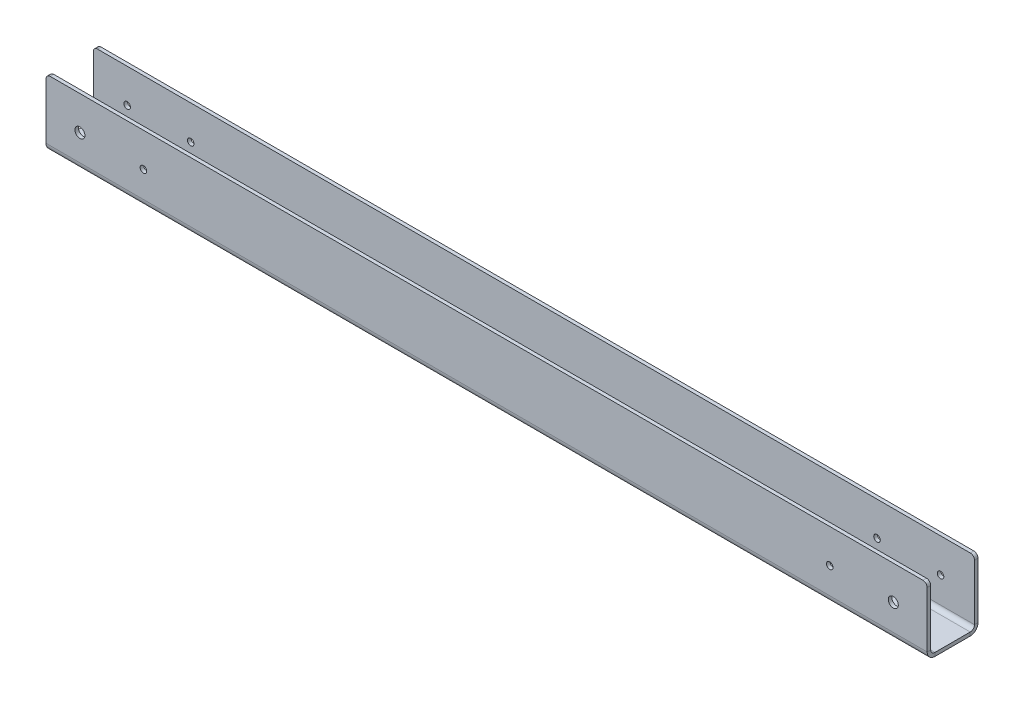
from build123d import *

# Parameters (mm, degrees)
SKETCH1_W                            = 660.4
SKETCH1_H                            = 38.1
BASE_FLANGE1_DEPTH                   = 2.65684
EDGE_FLANGE1_STRIP_W                 = 16.97736
EDGE_FLANGE1_STRIP_H                 = 2.65684
EDGE_FLANGE1_STRIP_CUT_DEPTH         = 660.4
EDGE_FLANGE1_STRIP_2_W               = 16.97736
EDGE_FLANGE1_STRIP_2_H               = 2.65684
EDGE_FLANGE1_STRIP_CUT_2_DEPTH       = 660.4
EDGE_FLANGE1_DEPTH                   = 660.4
EDGE_FLANGE1_BEND_DEPTH              = 660.4
F_10_0_1935_DIAMETER_HOLE2_D         = 4.9149
F_10_0_1935_DIAMETER_HOLE2_DEPTH     = 2.65684
FILLET1_R                            = 3.175
F_10_0_1935_DIAMETER_HOLE3_D         = 4.9149
F_19_64_0_29688_DIAMETER_HOLE1_D     = 7.540752
F_19_64_0_29688_DIAMETER_HOLE1_DEPTH = 2.65684


# Sheet-metal steps are written as plain solids
with BuildPart() as part:
    # Sketch1 → Base-Flange1 (new body)
    with BuildSketch(Plane(origin=(0, 0, 0), x_dir=(1, 0, 0), z_dir=(0, 1, 0))):
        with Locations((375.92, 15.875)):
            Rectangle(SKETCH1_W, SKETCH1_H)
    extrude(amount=-BASE_FLANGE1_DEPTH)

    # Edge-Flange1 strip (across the edge) → Edge-Flange1 strip cut (cut)
    with BuildSketch(Plane(origin=(45.72, 0, 3.175), x_dir=(0, 0, -1), z_dir=(1, 0, 0))):
        with Locations((-2.65684, -1.32842)):
            Rectangle(EDGE_FLANGE1_STRIP_W, EDGE_FLANGE1_STRIP_H)
    extrude(amount=EDGE_FLANGE1_STRIP_CUT_DEPTH, mode=Mode.SUBTRACT)

    # Edge-Flange1 strip 2 (across the edge) → Edge-Flange1 strip cut 2 (cut)
    with BuildSketch(Plane(origin=(706.12, 0, -34.925), x_dir=(0, 0, 1), z_dir=(-1, 0, 0))):
        with Locations((-2.65684, -1.32842)):
            Rectangle(EDGE_FLANGE1_STRIP_2_W, EDGE_FLANGE1_STRIP_2_H)
    extrude(amount=EDGE_FLANGE1_STRIP_CUT_2_DEPTH, mode=Mode.SUBTRACT)

    # Edge-Flange1 section (across the edge) → Edge-Flange1 (add)
    with BuildSketch(Plane(origin=(45.72, 0, 3.175), x_dir=(0, 0, -1), z_dir=(1, 0, 0))):
        with BuildLine():
            Line((0, 3.175), (0, 48.14316))
            Line((0, 48.14316), (2.65684, 48.14316))
            Line((2.65684, 48.14316), (2.65684, 3.175))
            ThreePointArc((2.65684, 3.175), (3.58677597, 0.92993597), (5.83184, 0))
            Line((5.83184, 0), (5.83184, -2.65684))
            ThreePointArc((5.83184, -2.65684), (1.708106389, -0.948733611), (0, 3.175))
        make_face()
    extrude(amount=EDGE_FLANGE1_DEPTH)

    # Edge-Flange1 section 2 (across the edge) → Edge-Flange1 bend (add)
    with BuildSketch(Plane(origin=(706.12, 0, -34.925), x_dir=(0, 0, 1), z_dir=(-1, 0, 0))):
        with BuildLine():
            Line((0, 3.175), (0, 48.14316))
            Line((0, 48.14316), (2.65684, 48.14316))
            Line((2.65684, 48.14316), (2.65684, 3.175))
            ThreePointArc((2.65684, 3.175), (3.58677597, 0.92993597), (5.83184, 0))
            Line((5.83184, 0), (5.83184, -2.65684))
            ThreePointArc((5.83184, -2.65684), (1.708106389, -0.948733611), (0, 3.175))
        make_face()
    extrude(amount=EDGE_FLANGE1_BEND_DEPTH)

    # #10 (0.1935) Diameter Hole2
    with Locations(Plane(origin=(0, 0, -34.925), x_dir=(-1, 0, 0), z_dir=(0, 0, -1))):
        with Locations((-680.72, 22.74316), (-633.095, 22.74316), (-118.745, 22.74316), (-71.12, 22.74316)):
            Hole(F_10_0_1935_DIAMETER_HOLE2_D / 2, depth=F_10_0_1935_DIAMETER_HOLE2_DEPTH)

    # Fillet1
    fillet1_edges = [part.edges().sort_by_distance(p)[0] for p in [
        (45.72, 48.14316, 1.84658),
        (706.12, 48.14316, 1.84658),
        (706.12, 48.14316, -33.59658),
        (45.72, 48.14316, -33.59658),
    ]]
    fillet(fillet1_edges, radius=FILLET1_R)

    # #10 (0.1935) Diameter Hole3 (through all)
    with Locations(Plane.XY.offset(3.175)):
        with Locations((633.095, 22.74316), (118.745, 22.74316)):
            Hole(F_10_0_1935_DIAMETER_HOLE3_D / 2)

    # 19/64 (0.29688) Diameter Hole1
    with Locations(Plane.XY.offset(3.175)):
        with Locations((71.12, 22.74316), (680.72, 22.74316)):
            Hole(F_19_64_0_29688_DIAMETER_HOLE1_D / 2, depth=F_19_64_0_29688_DIAMETER_HOLE1_DEPTH)


solid = part.part
